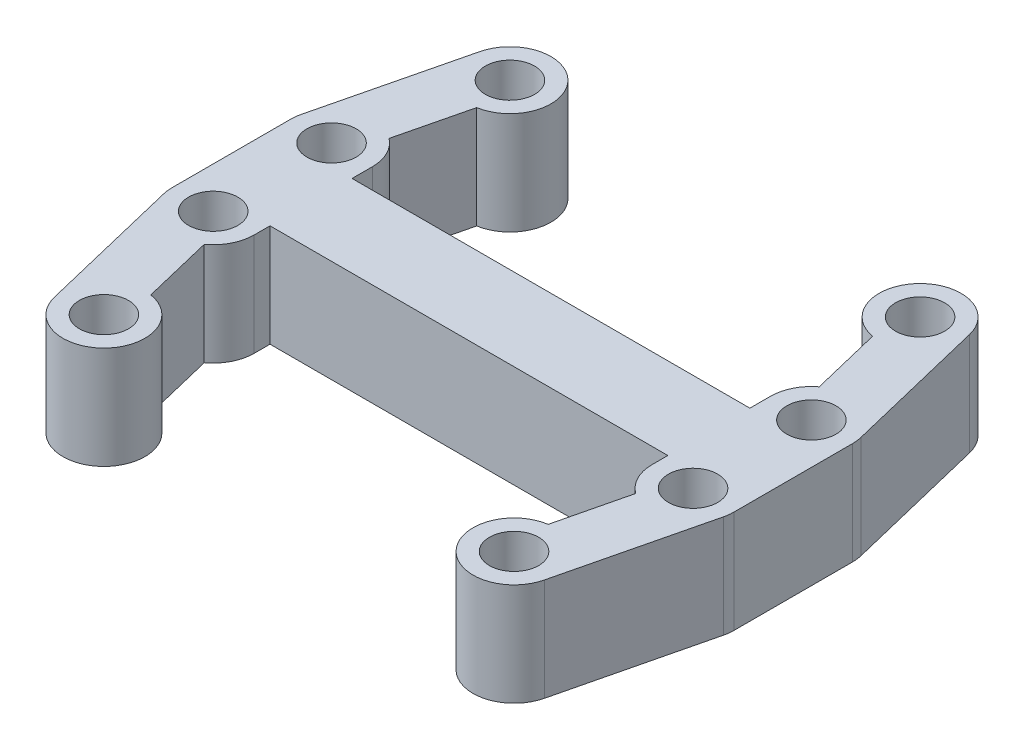
from build123d import *

# Parameters (mm, degrees)
SKETCH2_R           = 1.905
BOSS_EXTRUDE1_DEPTH = 7.9375


with BuildPart() as part:
    # Sketch2 → Boss-Extrude1 (new body)
    with BuildSketch(Plane(origin=(0, 0, 0), x_dir=(1, 0, 0), z_dir=(0, 1, 0))):
        with BuildLine():
            Line((-16.652885777, 7.290524058), (-15.327609815, 12.747542729))
            ThreePointArc((-15.327609815, 12.747542729), (-13.558199469, 18.045958382), (-18.96031801, 16.624291517))
            Line((-18.96031801, 16.624291517), (-21.65906801, 5.511791517))
            ThreePointArc((-21.65906801, 5.511791517), (-21.726249777, 5.139819704), (-21.74875, 4.7625))
            Line((-21.74875, 4.7625), (-21.74875, -4.397375))
            ThreePointArc((-21.74875, -4.397375), (-21.726434075, -4.773151689), (-21.659800003, -5.143645982))
            Line((-21.659800003, -5.143645982), (-18.961050003, -16.303770982))
            ThreePointArc((-18.961050003, -16.303770982), (-13.540192666, -17.709080747), (-15.382866617, -12.420872873))
            Line((-15.382866617, -12.420872873), (-16.702800144, -6.962559523))
            ThreePointArc((-16.702800144, -6.962559523), (-15.743476975, -5.836186872), (-15.39875, -4.397375))
            Line((-15.39875, -4.397375), (-15.39875, -3.175))
            Line((-15.39875, -3.175), (15.39875, -3.175))
            Line((15.39875, -3.175), (15.39875, -4.397375))
            ThreePointArc((15.39875, -4.397375), (15.743476975, -5.836186872), (16.702800144, -6.962559523))
            Line((16.702800144, -6.962559523), (15.382866617, -12.420872873))
            ThreePointArc((15.382866617, -12.420872873), (13.540192666, -17.709080747), (18.961050003, -16.303770982))
            Line((18.961050003, -16.303770982), (21.659800003, -5.143645982))
            ThreePointArc((21.659800003, -5.143645982), (21.726434075, -4.773151689), (21.74875, -4.397375))
            Line((21.74875, -4.397375), (21.74875, 4.7625))
            ThreePointArc((21.74875, 4.7625), (21.726249777, 5.139819704), (21.65906801, 5.511791517))
            Line((21.65906801, 5.511791517), (18.96031801, 16.624291517))
            ThreePointArc((18.96031801, 16.624291517), (13.558199469, 18.045958382), (15.327609815, 12.747542729))
            Line((15.327609815, 12.747542729), (16.652885777, 7.290524058))
            ThreePointArc((16.652885777, 7.290524058), (15.72951294, 6.173506926), (15.39875, 4.7625))
            Line((15.39875, 4.7625), (15.39875, 3.175))
            Line((15.39875, 3.175), (-15.39875, 3.175))
            Line((-15.39875, 3.175), (-15.39875, 4.7625))
            ThreePointArc((-15.39875, 4.7625), (-15.72951294, 6.173506926), (-16.652885777, 7.290524058))
        make_face()
        with Locations((-15.875, 15.875)):
            Circle(SKETCH2_R, mode=Mode.SUBTRACT)
        with Locations((-18.57375, 4.7625)):
            Circle(SKETCH2_R, mode=Mode.SUBTRACT)
        with Locations((-18.57375, -4.397375)):
            Circle(SKETCH2_R, mode=Mode.SUBTRACT)
        with Locations((-15.875, -15.5575)):
            Circle(SKETCH2_R, mode=Mode.SUBTRACT)
        with Locations((15.875, -15.5575)):
            Circle(SKETCH2_R, mode=Mode.SUBTRACT)
        with Locations((18.57375, -4.397375)):
            Circle(SKETCH2_R, mode=Mode.SUBTRACT)
        with Locations((18.57375, 4.7625)):
            Circle(SKETCH2_R, mode=Mode.SUBTRACT)
        with Locations((15.875, 15.875)):
            Circle(SKETCH2_R, mode=Mode.SUBTRACT)
    extrude(amount=BOSS_EXTRUDE1_DEPTH)


solid = part.part
